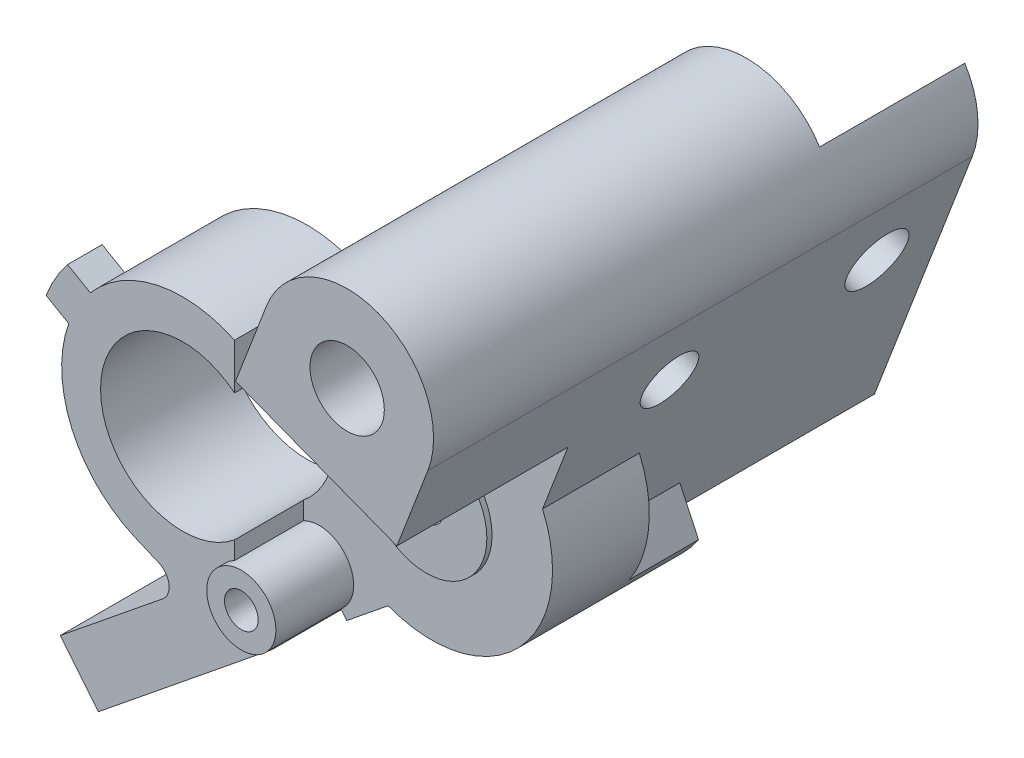
from build123d import *

# Parameters (mm, degrees)
SKETCH_1_R                  = 7
SKETCH_1_R_2                = 4.75
EXTRUDE_1_DEPTH             = 6.3
SKETCH_2_R                  = 7
SKETCH_2_R_2                = 2
EXTRUDE_2_DEPTH             = 1.8
CUT_EXTRUDE_START           = -4
CUT_EXTRUDE_1_DEPTH         = 4
EXTRUDE_START               = -4.1
SKETCH_4_R                  = 0.975
EXTRUDE_3_DEPTH             = 4.1
EXTRUDE_4_REACH             = 18.094
SKETCH_5_R                  = 2
SKETCH_5_R_2                = 0.975
EXTRUDE_4_DIRECTION_2_REACH = 18.094
SKETCH_6_R                  = 0.975
EXTRUDE_5_DEPTH             = 6.6
SKETCH_7_R                  = 0.975
EXTRUDE_6_DEPTH             = 1.6
EXTRUDE_7_DEPTH             = 4.1
EXTRUDE_START_2             = 2
EXTRUDE_8_DEPTH             = 2
CUT_EXTRUDE_2_DEPTH         = 19.287742604
EXTRUDE_9_DEPTH             = 4.1
EXTRUDE_10_DEPTH            = 1
EXTRUDE_10_DEPTH_BACK       = 4
SKETCH_12_W                 = 12.932716562
SKETCH_12_H                 = 7.6
SKETCH_12_R                 = 1.15
CUT_EXTRUDE_START_2         = -1.5
SKETCH_13_R                 = 0.975
CUT_EXTRUDE_3_DEPTH         = 1.5
EXTRUDE_12_DEPTH            = 3.5
FILLET_2_R                  = 1
CUT_EXTRUDE_START_3         = -0.5
CUT_EXTRUDE_4_DEPTH         = 0.5
CUT_EXTRUDE_5_DEPTH         = 0.5
EXTRUDE_START_3             = -5.6
EXTRUDE_14_DEPTH            = 5.6
CUT_EXTRUDE_6_DEPTH         = 26.902153922
EXTRUDE_START_4             = -3.6
SKETCH_21_R                 = 2.15
EXTRUDE_15_DEPTH            = 3.6
SKETCH_22_R                 = 5
SKETCH_22_R_2               = 2.15
EXTRUDE_16_DEPTH            = 9.9
EXTRUDE_19_DEPTH            = 2
CUT_EXTRUDE_8_DEPTH         = 31.424324472
CUT_EXTRUDE_9_DEPTH         = 1.5
EXTRUDE_21_DEPTH            = 2
EXTRUDE_22_DEPTH            = 2
EXTRUDE_START_5             = -2
EXTRUDE_23_DEPTH            = 2
EXTRUDE_START_6             = 18
EXTRUDE_24_DEPTH            = 18
SKETCH_37_R                 = 1.75
CUT_EXTRUDE_10_DEPTH        = 36.025431655
CUT_EXTRUDE_11_DEPTH        = 33.670927742
EXTRUDE_26_DEPTH            = 10
EXTRUDE_26_DEPTH_BACK       = 2
CUT_EXTRUDE_12_DEPTH        = 10
EXTRUDE_START_7             = 4
EXTRUDE_27_DEPTH            = 4
CUT_EXTRUDE_START_4         = -0.2
SKETCH_44_R                 = 3.5
CUT_EXTRUDE_13_DEPTH        = 0.2
FILLET_3_R                  = 5
CUT_EXTRUDE_14_DEPTH        = 0.4
EXTRUDE_START_8             = 10
EXTRUDE_28_DEPTH            = 10
EXTRUDE_29_DEPTH            = 6
EXTRUDE_30_DEPTH            = 12
SKETCH_49_R                 = 1.6
CUT_EXTRUDE_15_DEPTH        = 6
SKETCH_50_R                 = 2.15
EXTRUDE_31_DEPTH            = 7.1
EXTRUDE_32_DEPTH            = 9.9
EXTRUDE_33_DEPTH            = 9.9


# Read off the part's stored shape, not the designer's step: 凸台-拉伸14
with BuildPart() as part:
    # 草图1 → 凸台-拉伸1 (new body)
    with BuildSketch(Plane.XY):
        Circle(SKETCH_1_R)
        Circle(SKETCH_1_R_2, mode=Mode.SUBTRACT)
    extrude(amount=EXTRUDE_1_DEPTH)

    # 草图2 → 凸台-拉伸2 (add)
    with BuildSketch(Plane.XY.offset(6.3)):
        Circle(SKETCH_2_R)
        Circle(SKETCH_2_R_2, mode=Mode.SUBTRACT)
    extrude(amount=EXTRUDE_2_DEPTH)

    # 草图3 → 切除-拉伸1 (cut)
    with BuildSketch(Plane.XY.offset(8.1).offset(CUT_EXTRUDE_START)):
        with BuildLine():
            Line((3, 6.32455532), (3, -6.32455532))
            ThreePointArc((3, -6.32455532), (7, 0), (3, 6.32455532))
        make_face()
    extrude(amount=CUT_EXTRUDE_1_DEPTH, mode=Mode.SUBTRACT)

    # 草图4 → 凸台-拉伸3 (add)
    with BuildSketch(Plane.XY.offset(4.1).offset(EXTRUDE_START)):
        with BuildLine():
            Line((2.355769231, 6.591688049), (11.577884615, 3.295844024))
            ThreePointArc((11.577884615, 3.295844024), (13.9, 0), (11.577884615, -3.295844024))
            Line((11.577884615, -3.295844024), (2.355769231, -6.591688049))
            ThreePointArc((2.355769231, -6.591688049), (2.681213529, -6.46614986), (3, -6.32455532))
            ThreePointArc((3, -6.32455532), (7, 0), (3, 6.32455532))
            ThreePointArc((3, 6.32455532), (2.681213529, 6.46614986), (2.355769231, 6.591688049))
        make_face()
        with Locations((10.4, 0)):
            Circle(SKETCH_4_R, mode=Mode.SUBTRACT)
    extrude(amount=EXTRUDE_3_DEPTH)

    # 凸台-拉伸4: up to this face of the body (flat: up to its plane)
    extrude_4_end = Plane(part.part.faces().sort_by_distance((2.827953495, 0, 8.1))[0])
    # 草图5 → 凸台-拉伸4 (add, up to the picked face)
    with BuildSketch(Plane.XY.offset(4.1), mode=Mode.PRIVATE) as extrude_4_sk1:
        with Locations((3.894617613, -6.505382387)):
            Circle(SKETCH_5_R)
        with Locations((3.894617613, -6.505382387)):
            Circle(SKETCH_5_R_2, mode=Mode.SUBTRACT)
    extrude_4_tool1 = split(extrude(extrude_4_sk1.sketch, amount=EXTRUDE_4_REACH, mode=Mode.PRIVATE), bisect_by=extrude_4_end, keep=Keep.BOTH, mode=Mode.PRIVATE)
    add(extrude_4_tool1.solids().sort_by(Axis((1.951186, -6.505382, 4.1), (0, 0, 1)))[0])

    # 凸台-拉伸4 direction 2: up to this face of the body (flat: up to its plane)
    extrude_4_direction_2_end = Plane(part.part.faces().sort_by_distance((-6.748442849, 0, 0))[0])
    # 草图5 → 凸台-拉伸4 direction 2 (add, up to the picked face)
    with BuildSketch(Plane.XY.offset(4.1), mode=Mode.PRIVATE) as extrude_4_direction_2_sk1:
        with Locations((3.894617613, -6.505382387)):
            Circle(SKETCH_5_R)
        with Locations((3.894617613, -6.505382387)):
            Circle(SKETCH_5_R_2, mode=Mode.SUBTRACT)
    extrude_4_direction_2_tool1 = split(extrude(extrude_4_direction_2_sk1.sketch, amount=-EXTRUDE_4_DIRECTION_2_REACH, mode=Mode.PRIVATE), bisect_by=extrude_4_direction_2_end, keep=Keep.BOTH, mode=Mode.PRIVATE)
    add(extrude_4_direction_2_tool1.solids().sort_by(Axis((1.951186, -6.505382, 4.1), (0, 0, -1)))[0])

    # 草图6 → 凸台-拉伸5 (add)
    with BuildSketch(Plane(origin=(0, 0, 0), x_dir=(-1, 0, 0), z_dir=(0, 0, -1))):
        with Locations((-3.894617613, -6.505382387)):
            Circle(SKETCH_6_R)
    extrude(amount=-EXTRUDE_5_DEPTH)

    # 草图7 → 凸台-拉伸6 (add)
    with BuildSketch(Plane(origin=(0, 0, 0), x_dir=(-1, 0, 0), z_dir=(0, 0, -1))):
        with Locations(Location((-10.4, 0, 0), (0, 0, 180))):
            Circle(SKETCH_7_R)
    extrude(amount=-EXTRUDE_6_DEPTH)

    # 草图8 → 凸台-拉伸7 (add)
    with BuildSketch(Plane(origin=(0, 0, 0), x_dir=(-1, 0, 0), z_dir=(0, 0, -1))):
        with BuildLine():
            ThreePointArc((-11.577884615, -3.295844024), (-12.023769403, -3.100543972), (-12.438245142, -2.845269186))
            Line((-12.438245142, -2.845269186), (-5.059329123, -8.131250493))
            ThreePointArc((-5.059329123, -8.131250493), (-5.857511533, -6.888850066), (-5.585595832, -5.437397058))
            Line((-5.585595832, -5.437397058), (-11.577884615, -3.295844024))
        make_face()
        with BuildLine():
            ThreePointArc((-1.907841671, -6.734993701), (-2.348687888, -7.774280052), (-3.282091086, -8.409276096))
            Line((-3.282091086, -8.409276096), (2.143842843, -6.663627981))
            ThreePointArc((2.143842843, -6.663627981), (0.123277755, -6.998914387), (-1.907841671, -6.734993701))
        make_face()
    extrude(amount=-EXTRUDE_7_DEPTH)

    # 草图9 → 凸台-拉伸8 (add)
    with BuildSketch(Plane(origin=(0, 0, 0), x_dir=(-1, 0, 0), z_dir=(0, 0, -1)).offset(EXTRUDE_START_2)):
        with BuildLine():
            Line((-13.893898751, 0.206570848), (-2.122150074, -8.036096313))
            Line((-2.122150074, -8.036096313), (-3.282091086, -8.409276096))
            ThreePointArc((-3.282091086, -8.409276096), (-4.203731868, -8.481350093), (-5.059329123, -8.131250493))
            Line((-5.059329123, -8.131250493), (-12.438245142, -2.845269186))
            ThreePointArc((-12.438245142, -2.845269186), (-13.559048261, -1.50678933), (-13.893898751, 0.206570848))
        make_face()
    extrude(amount=-EXTRUDE_8_DEPTH)

    # 草图10 → 切除-拉伸2 (cut, through all)
    with BuildSketch(Plane(origin=(0, 0, 6.3), x_dir=(-1, 0, 0), z_dir=(0, 0, -1))):
        with BuildLine():
            Line((-3, 3.682729966), (-3, -3.682729966))
            ThreePointArc((-3, -3.682729966), (4.75, 0), (-3, 3.682729966))
        make_face()
    extrude(amount=-CUT_EXTRUDE_2_DEPTH, mode=Mode.SUBTRACT)

    # 草图11 → 凸台-拉伸9 (add)
    with BuildSketch(Plane.XY.offset(4.1).offset(EXTRUDE_START)):
        with BuildLine():
            Line((12.602621369, -2.720010865), (5.492045563, -8.47804162))
            ThreePointArc((5.492045563, -8.47804162), (4.24689632, -9.019156485), (2.900970325, -8.841153259))
            Line((2.900970325, -8.841153259), (-2.740190881, -6.441378264))
            ThreePointArc((-2.740190881, -6.441378264), (-2.444543943, -6.559283872), (-2.143842843, -6.663627981))
            Line((-2.143842843, -6.663627981), (3.282091086, -8.409276096))
            ThreePointArc((3.282091086, -8.409276096), (4.203731868, -8.481350093), (5.059329123, -8.131250493))
            Line((5.059329123, -8.131250493), (12.438245142, -2.845269186))
            ThreePointArc((12.438245142, -2.845269186), (12.521357962, -2.783853516), (12.602621369, -2.720010865))
        make_face()
    extrude(amount=EXTRUDE_9_DEPTH)

    # 草图12 → 凸台-拉伸10 (add, two sides: drawn at the far end of the back side and taken through both)
    with BuildSketch(Plane(origin=(6.321480576, -7.806378389, 0), x_dir=(0.7771459614569697, 0.629320391049839, 0), z_dir=(0.629320391049839, -0.7771459614569697, 0)).offset(-EXTRUDE_10_DEPTH_BACK)):
        with Locations((-7.533641719, 3.8)):
            Rectangle(SKETCH_12_W, SKETCH_12_H)
        with Locations((-10, 2.5)):
            Circle(SKETCH_12_R, mode=Mode.SUBTRACT)
    extrude(amount=EXTRUDE_10_DEPTH + EXTRUDE_10_DEPTH_BACK)

    # 草图13 → 切除-拉伸3 (cut)
    with BuildSketch(Plane.XY.offset(8.1).offset(CUT_EXTRUDE_START_2)):
        with Locations(Location((3.894617613, -6.505382387, 0), (0, 0, 180))):
            Circle(SKETCH_13_R)
    extrude(amount=CUT_EXTRUDE_3_DEPTH, mode=Mode.SUBTRACT)

    # 草图15 → 凸台-拉伸12 (add)
    with BuildSketch(Plane.XY.offset(4.1)):
        with BuildLine():
            Line((-2.740190881, -6.441378264), (0.138688588, -7.666066358))
            Line((0.138688588, -7.666066358), (1.061105347, -6.919107995))
            ThreePointArc((1.061105347, -6.919107995), (-0.872862235, -6.94536619), (-2.740190881, -6.441378264))
        make_face()
    extrude(amount=EXTRUDE_12_DEPTH)

    # 圆角2
    fillet_2_edges = [part.edges().sort_by_distance(p)[0] for p in [
        (0.138688588, -7.666066358, 3.8),
    ]]
    fillet(fillet_2_edges, radius=FILLET_2_R)

    # 草图17 → 切除-拉伸4 (cut)
    with BuildSketch(Plane.XY.offset(8.1).offset(CUT_EXTRUDE_START_3)):
        with BuildLine():
            ThreePointArc((3, -4.716623229), (2.135623001, -5.553574658), (1.907841671, -6.734993701))
            ThreePointArc((1.907841671, -6.734993701), (-6.975649262, 0.583367269), (3, 6.32455532))
            Line((3, 6.32455532), (3, 3.682729966))
            ThreePointArc((3, 3.682729966), (-4.75, 0), (3, -3.682729966))
            Line((3, -3.682729966), (3, -4.716623229))
        make_face()
    extrude(amount=CUT_EXTRUDE_4_DEPTH, mode=Mode.SUBTRACT)

    # 草图18 → 切除-拉伸5 (cut)
    with BuildSketch(Plane.XY.offset(4.1).offset(CUT_EXTRUDE_START_3)):
        with BuildLine():
            Line((5.153258395, -8.05967431), (5.492045563, -8.47804162))
            Line((5.492045563, -8.47804162), (12.602621369, -2.720010865))
            ThreePointArc((12.602621369, -2.720010865), (6.949698174, -0.587722137), (11.577884615, 3.295844024))
            Line((11.577884615, 3.295844024), (2.355769231, 6.591688049))
            ThreePointArc((2.355769231, 6.591688049), (2.681213529, 6.46614986), (3, 6.32455532))
            Line((3, 6.32455532), (3, 3.682729966))
            ThreePointArc((3, 3.682729966), (4.75, 0), (3, -3.682729966))
            Line((3, -3.682729966), (3, -4.716623229))
            ThreePointArc((3, -4.716623229), (5.576023528, -5.422389243), (5.153258395, -8.05967431))
        make_face()
    extrude(amount=CUT_EXTRUDE_5_DEPTH, mode=Mode.SUBTRACT)

    # 凸台-拉伸14 outline → 凸台-拉伸14 (add)
    with BuildSketch(Plane.XY.offset(3.6).offset(EXTRUDE_START_3)):
        with BuildLine():
            ThreePointArc((7.891424353, -6.535062985), (17.300603652, 1.175444274), (5.869315311, 5.336000024))
            Line((5.869315311, 5.336000024), (11.577884615, 3.295844024))
            ThreePointArc((11.577884615, 3.295844024), (13.200409282, 2.09945418), (13.893898751, 0.206570848))
            ThreePointArc((13.893898751, 0.206570848), (13.602156383, -1.412867474), (12.602621369, -2.720010865))
            Line((12.602621369, -2.720010865), (7.891424353, -6.535062985))
        make_face()
    extrude(amount=EXTRUDE_14_DEPTH)

    # 草图20 → 切除-拉伸6 (cut, through all)
    with BuildSketch(Plane(origin=(0, 0, 0), x_dir=(-1, 0, 0), z_dir=(0, 0, -1))):
        with BuildLine():
            Line((-13.893898751, 0.206570848), (-16.985983121, 2.371671633))
            ThreePointArc((-16.985983121, 2.371671633), (-12.203572459, 6.763662202), (-5.869315311, 5.336000024))
            Line((-5.869315311, 5.336000024), (-11.577884615, 3.295844024))
            ThreePointArc((-11.577884615, 3.295844024), (-13.200409282, 2.09945418), (-13.893898751, 0.206570848))
        make_face()
    extrude(amount=CUT_EXTRUDE_6_DEPTH, mode=Mode.SUBTRACT)

    # 草图21 → 凸台-拉伸15 (add)
    with BuildSketch(Plane.XY.offset(3.6).offset(EXTRUDE_START_4)):
        with BuildLine():
            Line((10.749249161, 14.861965719), (7.487735101, 6.365431105))
            ThreePointArc((7.487735101, 6.365431105), (12.908575647, 6.535062985), (16.823539366, 2.78175161))
            Line((16.823539366, 2.78175161), (20.085053426, 11.278286223))
            ThreePointArc((20.085053426, 11.278286223), (17.208991041, 17.738028103), (10.749249161, 14.861965719))
        make_face()
        with Locations((15.417151294, 13.070125971)):
            Circle(SKETCH_21_R, mode=Mode.SUBTRACT)
    extrude(amount=EXTRUDE_15_DEPTH)

    # 草图22 → 凸台-拉伸16 (add)
    with BuildSketch(Plane.XY.offset(3.6)):
        with Locations((15.417151294, 13.070125971)):
            Circle(SKETCH_22_R)
        with Locations((15.417151294, 13.070125971)):
            Circle(SKETCH_22_R_2, mode=Mode.SUBTRACT)
    extrude(amount=EXTRUDE_16_DEPTH)

    # 草图26 → 凸台-拉伸19 (add)
    with BuildSketch(Plane(origin=(0, 0, 0), x_dir=(-1, 0, 0), z_dir=(0, 0, -1)).offset(EXTRUDE_START_2)):
        with BuildLine():
            Line((3.929242493, -17.394009825), (-9.064960772, -6.871511497))
            ThreePointArc((-9.064960772, -6.871511497), (-8.470843908, -6.728919436), (-7.891424353, -6.535062985))
            Line((-7.891424353, -6.535062985), (-12.602621369, -2.720010865))
            ThreePointArc((-12.602621369, -2.720010865), (-12.521357962, -2.783853516), (-12.438245142, -2.845269186))
            Line((-12.438245142, -2.845269186), (-5.059329123, -8.131250493))
            ThreePointArc((-5.059329123, -8.131250493), (-4.203731868, -8.481350093), (-3.282091086, -8.409276096))
            Line((-3.282091086, -8.409276096), (-0.375625113, -7.474198943))
            Line((-0.375625113, -7.474198943), (7.075844448, -13.508280018))
            Line((7.075844448, -13.508280018), (3.929242493, -17.394009825))
        make_face()
    extrude(amount=-EXTRUDE_19_DEPTH)

    # 草图29 → 切除-拉伸8 (cut, through all)
    with BuildSketch(Plane(origin=(0, 0, 0), x_dir=(-1, 0, 0), z_dir=(0, 0, -1))):
        with BuildLine():
            Line((-17.382050899, -0.500964319), (-3.914897366, -6.780801145))
            Line((-3.914897366, -6.780801145), (-16.985983121, 2.371671633))
            ThreePointArc((-16.985983121, 2.371671633), (-17.334399478, 0.956087801), (-17.382050899, -0.500964319))
        make_face()
    extrude(amount=CUT_EXTRUDE_8_DEPTH, mode=Mode.SUBTRACT)

    # 草图32 → 切除-拉伸9 (cut)
    with BuildSketch(Plane(origin=(6.950800967, -8.58352435, 0), x_dir=(0.7771459614569697, 0.6293203910498391, 0), z_dir=(0.6293203910498391, -0.7771459614569698, 0))):
        Polygon((-1.067283438, 0), (-1.067283438, 7.6), (-14, 7.6), (-14, -2), (2.720415352, -2), (2.720415352, 0), align=None)
    extrude(amount=-CUT_EXTRUDE_9_DEPTH, mode=Mode.SUBTRACT)

    # 草图30 → 凸台-拉伸21 (add)
    with BuildSketch(Plane(origin=(0, 0, -2), x_dir=(-1, 0, 0), z_dir=(0, 0, -1))):
        Polygon((-3.914897366, -6.780801145), (-1.590034558, -7.864902477), (-2.122150074, -8.036096313), align=None)
    extrude(amount=-EXTRUDE_21_DEPTH)

    # 草图33 → 凸台-拉伸22 (add)
    with BuildSketch(Plane(origin=(0, 0, 0), x_dir=(-1, 0, 0), z_dir=(0, 0, -1)).offset(EXTRUDE_START_2)):
        with BuildLine():
            Line((-7.891424353, -6.535062985), (-5.492045563, -8.47804162))
            Line((-5.492045563, -8.47804162), (-5.177385367, -8.089468639))
            Line((-5.177385367, -8.089468639), (-8.120980185, -5.705792555))
            Line((-8.120980185, -5.705792555), (-9.064960772, -6.871511497))
            ThreePointArc((-9.064960772, -6.871511497), (-8.470843908, -6.728919436), (-7.891424353, -6.535062985))
        make_face()
    extrude(amount=-EXTRUDE_22_DEPTH)

    # 草图34 → 凸台-拉伸23 (add)
    with BuildSketch(Plane.XY.offset(7.6).offset(EXTRUDE_START_5)):
        with BuildLine():
            Line((-6.65618294, 5.286324685), (-5.339740145, 4.526276083))
            ThreePointArc((-5.339740145, 4.526276083), (-6.062177826, 3.5), (-6.589740145, 2.361212574))
            Line((-6.589740145, 2.361212574), (-7.90618294, 3.121261175))
            ThreePointArc((-7.90618294, 3.121261175), (-7.361215932, 4.25), (-6.65618294, 5.286324685))
        make_face()
    extrude(amount=EXTRUDE_23_DEPTH)

    # 草图36 → 凸台-拉伸24 (add)
    with BuildSketch(Plane(origin=(0, 0, 0), x_dir=(-1, 0, 0), z_dir=(0, 0, -1)).offset(EXTRUDE_START_6)):
        with BuildLine():
            Line((-19.651364371, 15.729343828), (-15.350948977, 4.52637871))
            Line((-15.350948977, 4.52637871), (-17.21810983, 3.809642811))
            Line((-17.21810983, 3.809642811), (-20.085053426, 11.278286223))
            ThreePointArc((-20.085053426, 11.278286223), (-20.393584982, 13.555005075), (-19.651364371, 15.729343828))
        make_face()
    extrude(amount=-EXTRUDE_24_DEPTH)

    # 草图37 → 切除-拉伸10 (cut, through all)
    with BuildSketch(Plane(origin=(11.865094372, -4.554583002, 0), x_dir=(0.35836794954529744, 0.933580426497203, 0), z_dir=(-0.933580426497203, 0.35836794954529744, 0))):
        with Locations(Location((13.496026675, 14, 0), (0, 0, 180))):
            Circle(SKETCH_37_R)
    extrude(amount=-CUT_EXTRUDE_10_DEPTH, mode=Mode.SUBTRACT)

    # 草图39 → 切除-拉伸11 (cut, through all)
    with BuildSketch(Plane(origin=(0, 0, 0), x_dir=(-1, 0, 0), z_dir=(0, 0, -1))):
        Polygon((-1.590034558, -7.864902477), (2.410569302, -9.730414694), (-0.375625113, -7.474198943), align=None)
    extrude(amount=CUT_EXTRUDE_11_DEPTH, mode=Mode.SUBTRACT)

    # 草图40 → 凸台-拉伸26 (add, two sides: drawn at the far end of the back side and taken through both)
    with BuildSketch(Plane(origin=(0, 0, -2), x_dir=(-1, 0, 0), z_dir=(0, 0, -1)).offset(-EXTRUDE_26_DEPTH_BACK)):
        with BuildLine():
            Line((-17.382050899, -0.500964319), (-12.557553919, -2.750664208))
            Line((-12.557553919, -2.750664208), (-15.350948977, 4.52637871))
            Line((-15.350948977, 4.52637871), (-17.21810983, 3.809642811))
            Line((-17.21810983, 3.809642811), (-16.823539366, 2.78175161))
            ThreePointArc((-16.823539366, 2.78175161), (-17.300834627, 1.174087496), (-17.382050899, -0.500964319))
        make_face()
    extrude(amount=EXTRUDE_26_DEPTH + EXTRUDE_26_DEPTH_BACK)

    # 草图42 → 切除-拉伸12 (cut)
    with BuildSketch(Plane(origin=(0, 0, -12), x_dir=(-1, 0, 0), z_dir=(0, 0, -1))):
        with BuildLine():
            Line((-16.823539366, 2.78175161), (-15.166916523, -1.533898443))
            Line((-15.166916523, -1.533898443), (-17.382050899, -0.500964319))
            ThreePointArc((-17.382050899, -0.500964319), (-17.300834627, 1.174087496), (-16.823539366, 2.78175161))
        make_face()
    extrude(amount=-CUT_EXTRUDE_12_DEPTH, mode=Mode.SUBTRACT)

    # 草图43 → 凸台-拉伸27 (add)
    with BuildSketch(Plane(origin=(0, 0, -2), x_dir=(-1, 0, 0), z_dir=(0, 0, -1)).offset(EXTRUDE_START_7)):
        with BuildLine():
            Line((-15.166916523, -1.533898443), (2.410569302, -9.730414694))
            Line((2.410569302, -9.730414694), (0.870921378, -12.987290869))
            Line((0.870921378, -12.987290869), (-5.177385367, -8.089468639))
            Line((-5.177385367, -8.089468639), (-5.492045563, -8.47804162))
            Line((-5.492045563, -8.47804162), (-7.891424353, -6.535062985))
            ThreePointArc((-7.891424353, -6.535062985), (-12.542180804, -6.664162468), (-16.246609113, -3.849306675))
            Line((-16.246609113, -3.849306675), (-15.166916523, -1.533898443))
        make_face()
    extrude(amount=-EXTRUDE_27_DEPTH)

    # 草图44 → 切除-拉伸13 (cut)
    with BuildSketch(Plane.XY.offset(4.1).offset(CUT_EXTRUDE_START_4)):
        with Locations((10.4, 0)):
            Circle(SKETCH_44_R)
    extrude(amount=CUT_EXTRUDE_13_DEPTH, mode=Mode.SUBTRACT)

    # 圆角3
    fillet_3_edges = [part.edges().sort_by_distance(p)[0] for p in [
        (12.557553919, -2.750664208, -3),
    ]]
    fillet(fillet_3_edges, radius=FILLET_3_R)

    # 草图45 → 切除-拉伸14 (cut)
    with BuildSketch(Plane(origin=(0, 0, 0), x_dir=(-1, 0, 0), z_dir=(0, 0, -1))):
        with BuildLine():
            Line((-19.651364371, 15.729343828), (-13.28150417, -0.864709327))
            ThreePointArc((-13.28150417, -0.864709327), (-12.270370545, -2.482861379), (-10.726693346, -3.604408514))
            Line((-10.726693346, -3.604408514), (2.410569302, -9.730414694))
            Line((2.410569302, -9.730414694), (1.153546777, -8.712497924))
            ThreePointArc((1.153546777, -8.712497924), (0.792544381, -7.796568755), (1.391411328, -7.015155068))
            Line((1.391411328, -7.015155068), (2.740190881, -6.441378264))
            ThreePointArc((2.740190881, -6.441378264), (6.519367253, 2.549088195), (-2.355769231, 6.591688049))
            Line((-2.355769231, 6.591688049), (-5.869315311, 5.336000024))
            ThreePointArc((-5.869315311, 5.336000024), (-6.643098786, 5.906411201), (-7.487735101, 6.365431105))
            Line((-7.487735101, 6.365431105), (-10.749249161, 14.861965719))
            ThreePointArc((-10.749249161, 14.861965719), (-14.93227219, 18.046559659), (-19.651364371, 15.729343828))
        make_face()
    extrude(amount=-CUT_EXTRUDE_14_DEPTH, mode=Mode.SUBTRACT)

    # 草图46 → 凸台-拉伸28 (add)
    with BuildSketch(Plane(origin=(0, 0, 0.4), x_dir=(-1, 0, 0), z_dir=(0, 0, -1)).offset(EXTRUDE_START_8)):
        with BuildLine():
            Line((-19.651364371, 15.729343828), (-13.28150417, -0.864709327))
            ThreePointArc((-13.28150417, -0.864709327), (-13.246034382, -0.954509971), (-13.208837205, -1.04360897))
            ThreePointArc((-13.208837205, -1.04360897), (-12.299699436, 4.927463221), (-8.834799924, 9.874654946))
            Line((-8.834799924, 9.874654946), (-10.749249161, 14.861965719))
            ThreePointArc((-10.749249161, 14.861965719), (-14.93227219, 18.046559659), (-19.651364371, 15.729343828))
        make_face()
    extrude(amount=-EXTRUDE_28_DEPTH)

    # 草图47 → 凸台-拉伸29 (add)
    with BuildSketch(Plane(origin=(0, 0, -12), x_dir=(-1, 0, 0), z_dir=(0, 0, -1))):
        Polygon((-17.21810983, 3.809642811), (-15.166916523, -1.533898443), (-12.557553919, -2.750664208), (-15.350948977, 4.52637871), align=None)
    extrude(amount=EXTRUDE_29_DEPTH)

    # 草图48 → 凸台-拉伸30 (add)
    with BuildSketch(Plane(origin=(0, 0, -6), x_dir=(-1, 0, 0), z_dir=(0, 0, -1))):
        Polygon((-15.166916523, -1.533898443), (-14.424714772, -3.467400107), (-12.557553919, -2.750664208), align=None)
    extrude(amount=EXTRUDE_30_DEPTH)

    # 草图49 → 切除-拉伸15 (cut)
    with BuildSketch(Plane(origin=(13.732255225, -5.271318901, 0), x_dir=(0, 0, -1), z_dir=(0.9335804264972031, -0.3583679495452971, 0))):
        with Locations(Location((2, 13.496026675, 0), (0, 0, 90))):
            Circle(SKETCH_49_R)
    extrude(amount=-CUT_EXTRUDE_15_DEPTH, mode=Mode.SUBTRACT)

    # 草图50 → 凸台-拉伸31 (add)
    with BuildSketch(Plane.XY.offset(0.4)):
        with Locations((15.417151294, 13.070125971)):
            Circle(SKETCH_50_R)
    extrude(amount=EXTRUDE_31_DEPTH)

    # 草图51 → 凸台-拉伸32 (add)
    with BuildSketch(Plane.XY.offset(3.6)):
        with BuildLine():
            Line((10.749249161, 14.861965719), (8.957409413, 10.194063586))
            Line((8.957409413, 10.194063586), (13.625311546, 8.402223838))
            ThreePointArc((13.625311546, 8.402223838), (10.849424005, 11.036442756), (10.749249161, 14.861965719))
        make_face()
    extrude(amount=EXTRUDE_32_DEPTH)

    # 草图52 → 凸台-拉伸33 (add)
    with BuildSketch(Plane.XY.offset(3.6)):
        with BuildLine():
            Line((20.085053426, 11.278286223), (18.293213678, 6.610384091))
            Line((18.293213678, 6.610384091), (13.625311546, 8.402223838))
            ThreePointArc((13.625311546, 8.402223838), (17.450834509, 8.502398683), (20.085053426, 11.278286223))
        make_face()
    extrude(amount=EXTRUDE_33_DEPTH)


solid = part.part
